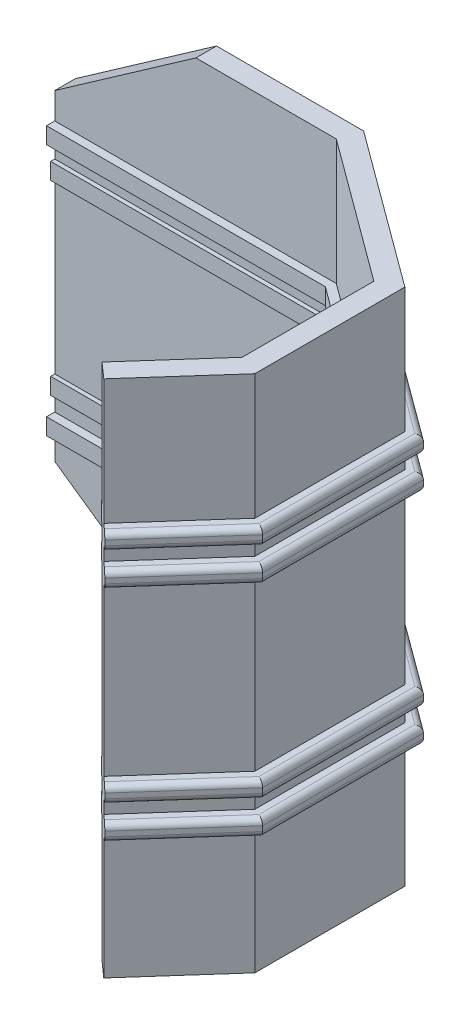
from build123d import *

# Parameters (mm, degrees)
EXTRUDE_1_DEPTH        = 31.5
EXTRUDE_1_DEPTH_BACK   = 31.5
CHAMFER_1_SIZE         = 12
CHAMFER_1_SIZE2        = 17.137776081
EXTRUDE_1_2_DEPTH      = 2
EXTRUDE_2_DEPTH        = 2
FILLET_1_R             = 0.7
FILLET_1_OF_MIRROR_1_R = 0.7


with BuildPart() as part:
    # 草图1 → Extrude 1 (new, two sides: drawn at the far end of the back side and taken through both)
    with BuildSketch(Plane(origin=(0, 0, 0), x_dir=(1, 0, 0), z_dir=(0, 1, 0)).offset(-EXTRUDE_1_DEPTH_BACK)):
        Polygon((0, -8), (0, 8), (-17.240931671, 20.67715564), (-51.420742101, 20.67715564), (-51.420742101, 23.17715564), (-16.420742101, 23.17715564), (2.5, 9.264845271), (2.5, -8.950498306), (-6.131476703, -18.660909597), (-8, -17), align=None)
    extrude(amount=EXTRUDE_1_DEPTH + EXTRUDE_1_DEPTH_BACK)

    # 倒角1
    chamfer_1_edges = [part.edges().sort_by_distance(p)[0] for p in [
        (-51.420742101, -31.5, -21.92715564),
        (-51.420742101, 31.5, -21.92715564),
    ]]
    chamfer_1_side = [part.faces().sort_by_distance(p)[0] for p in [
        (-51.420742101, 0, -21.92715564),
    ]]
    chamfer(chamfer_1_edges, length=CHAMFER_1_SIZE, length2=CHAMFER_1_SIZE2, reference=chamfer_1_side[0])

    # 草图4 → Extrude 1 2 (add)
    with BuildSketch(Plane(origin=(0, 12.3, 0), x_dir=(1, 0, 0), z_dir=(0, 1, 0))):
        Polygon((-6.131476703, -18.660909597), (2.5, -8.950498306), (2.5, 9.264845271), (-16.420742101, 23.17715564), (-34.282966021, 23.17715564), (-51.420742101, 23.17715564), (-51.420742101, 20.17715564), (-34.282966021, 20.17715564), (-17.404969585, 20.17715564), (-0.5, 7.747030946), (-0.5, -7.809900339), (-8.373704659, -16.667818081), align=None)
        Polygon((-5.010362725, -19.657455355), (4, -9.520797289), (4, 10.023752434), (-15.92862836, 24.67715564), (-34.282966021, 24.67715564), (-51.420742101, 24.67715564), (-51.420742101, 21.67715564), (-34.282966021, 21.67715564), (-16.912855843, 21.67715564), (1, 8.505938109), (1, -8.380199322), (-7.252590681, -17.664363839), align=None)
    extrude_1_2 = extrude(amount=-EXTRUDE_1_2_DEPTH)

    # 草图5 → 拉伸-薄壁2 (add)
    with BuildSketch(Plane(origin=(0, 16.3, 0), x_dir=(1, 0, 0), z_dir=(0, 1, 0))):
        Polygon((-6.131476703, -18.660909597), (2.5, -8.950498306), (2.5, 9.264845271), (-16.420742101, 23.17715564), (-34.282966021, 23.17715564), (-51.420742101, 23.17715564), (-51.420742101, 19.67715564), (-34.282966021, 19.67715564), (-17.569007498, 19.67715564), (-1, 7.494061891), (-1, -7.619800678), (-8.747409319, -16.335636161), align=None)
        Polygon((-5.010362725, -19.657455355), (4, -9.520797289), (4, 10.023752434), (-15.92862836, 24.67715564), (-34.282966021, 24.67715564), (-51.420742101, 24.67715564), (-51.420742101, 21.17715564), (-34.282966021, 21.17715564), (-17.076893757, 21.17715564), (0.5, 8.252969054), (0.5, -8.190099661), (-7.626295341, -17.332181919), align=None)
    extrude_2 = extrude(amount=-EXTRUDE_2_DEPTH)

    # 圆角1
    fillet_1_edges = [part.edges().sort_by_distance(p)[0] for p in [
        (-0.505181363, 10.3, 14.589126322),
        (4, 10.3, -0.251477572),
        (-5.96431418, 10.3, -17.350454037),
        (-33.674685231, 10.3, -24.67715564),
        (-0.505181363, 12.3, 14.589126322),
        (4, 12.3, -0.251477572),
        (-5.96431418, 12.3, -17.350454037),
        (-33.674685231, 12.3, -24.67715564),
        (-33.674685231, 14.3, -24.67715564),
        (-5.96431418, 14.3, -17.350454037),
        (4, 14.3, -0.251477572),
        (-0.505181363, 14.3, 14.589126322),
        (-0.505181363, 16.3, 14.589126322),
        (4, 16.3, -0.251477572),
        (-5.96431418, 16.3, -17.350454037),
        (-33.674685231, 16.3, -24.67715564),
    ]]
    fillet(fillet_1_edges, radius=FILLET_1_R)

    # 镜向1: Extrude 1 2, 拉伸-薄壁2 across plane
    add(extrude_1_2.mirror(Plane.ZX))
    add(extrude_2.mirror(Plane.ZX))

    # 圆角1 of 镜向1
    fillet_1_of_mirror_1_edges = [part.edges().sort_by_distance(p)[0] for p in [
        (-0.505181363, -10.3, 14.589126322),
        (4, -10.3, -0.251477572),
        (-5.96431418, -10.3, -17.350454037),
        (-33.674685231, -10.3, -24.67715564),
        (-0.505181363, -12.3, 14.589126322),
        (4, -12.3, -0.251477572),
        (-5.96431418, -12.3, -17.350454037),
        (-33.674685231, -12.3, -24.67715564),
        (-33.674685231, -14.3, -24.67715564),
        (-5.96431418, -14.3, -17.350454037),
        (4, -14.3, -0.251477572),
        (-0.505181363, -14.3, 14.589126322),
        (-0.505181363, -16.3, 14.589126322),
        (4, -16.3, -0.251477572),
        (-5.96431418, -16.3, -17.350454037),
        (-33.674685231, -16.3, -24.67715564),
    ]]
    fillet(fillet_1_of_mirror_1_edges, radius=FILLET_1_OF_MIRROR_1_R)


solid = part.part
